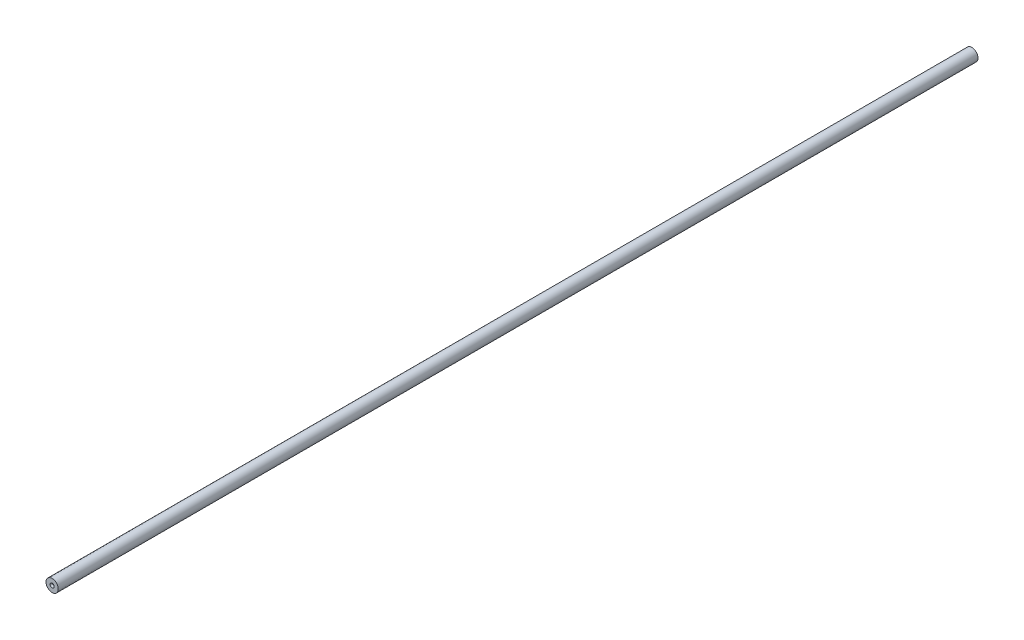
from build123d import *

# Parameters (mm, degrees)
SKETCH1_R           = 8
BOSS_EXTRUDE1_DEPTH = 600


with BuildPart() as part:
    # Sketch1 → Boss-Extrude1 (new, symmetric)
    with BuildSketch(Plane.XY):
        Circle(SKETCH1_R)
    extrude(amount=BOSS_EXTRUDE1_DEPTH, both=True)

    # Sketch4 → CSK for M2.5 Flat Head Machine Screw1 (revolve, cut)
    with BuildSketch(Plane(origin=(0, 0, -600), x_dir=(0, 1, 0), z_dir=(1, 0, 0))):
        Polygon((0, 0), (0, 5), (1.45, 4.128752102), (1.45, 2.25166605), (2.75, 0), align=None)
    csk_for_m2_5_flat_head_machine_screw1 = revolve(axis=Axis((0, 0, -606.35), (0, 0, 1)), mode=Mode.SUBTRACT)

    # Mirror1: CSK for M2.5 Flat Head Machine Screw1 across plane
    add(csk_for_m2_5_flat_head_machine_screw1.mirror(Plane.XY), mode=Mode.SUBTRACT)


solid = part.part
